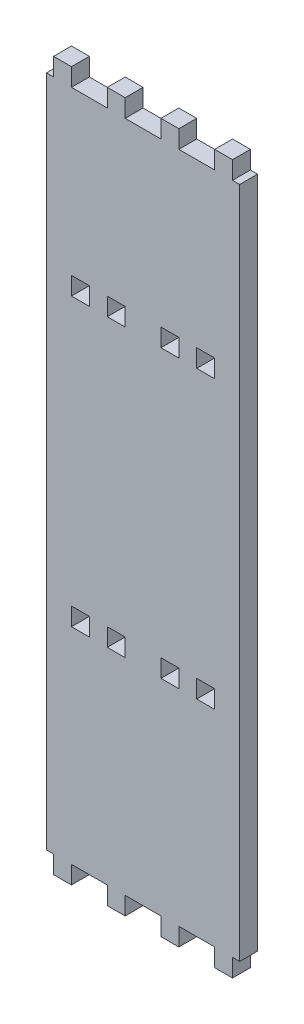
from build123d import *

# Parameters (mm, degrees)
ESQUISSE1_W        = 5
ESQUISSE1_H        = 5
BOSS_EXTRU_1_DEPTH = 5


with BuildPart() as part:
    # Esquisse1 → Boss.-Extru.1 (new body)
    with BuildSketch(Plane.XY):
        Polygon((-25, 193), (-25, 188), (-27, 188), (-27, 0), (-25, 0), (-25, -5), (-20, -5), (-20, 0), (-15, 0), (-10, 0), (-10, -5), (-5, -5), (-5, 0), (5, 0), (5, -5), (10, -5), (10, 0), (15, 0), (20, 0), (20, -5), (25, -5), (25, 0), (27, 0), (27, 188), (25, 188), (25, 193), (20, 193), (20, 188), (15, 188), (10, 188), (10, 193), (5, 193), (5, 188), (-5, 188), (-5, 193), (-10, 193), (-10, 188), (-15, 188), (-20, 188), (-20, 193), align=None)
        with Locations((-17.5, 60)):
            Rectangle(ESQUISSE1_W, ESQUISSE1_H, mode=Mode.SUBTRACT)
        with Locations((-7.5, 60)):
            Rectangle(ESQUISSE1_W, ESQUISSE1_H, mode=Mode.SUBTRACT)
        with Locations((7.5, 60)):
            Rectangle(ESQUISSE1_W, ESQUISSE1_H, mode=Mode.SUBTRACT)
        with Locations((17.5, 60)):
            Rectangle(ESQUISSE1_W, ESQUISSE1_H, mode=Mode.SUBTRACT)
        with Locations((-17.5, 140)):
            Rectangle(ESQUISSE1_W, ESQUISSE1_H, mode=Mode.SUBTRACT)
        with Locations((-7.5, 140)):
            Rectangle(ESQUISSE1_W, ESQUISSE1_H, mode=Mode.SUBTRACT)
        with Locations((7.5, 140)):
            Rectangle(ESQUISSE1_W, ESQUISSE1_H, mode=Mode.SUBTRACT)
        with Locations((17.5, 140)):
            Rectangle(ESQUISSE1_W, ESQUISSE1_H, mode=Mode.SUBTRACT)
    extrude(amount=BOSS_EXTRU_1_DEPTH)


solid = part.part
